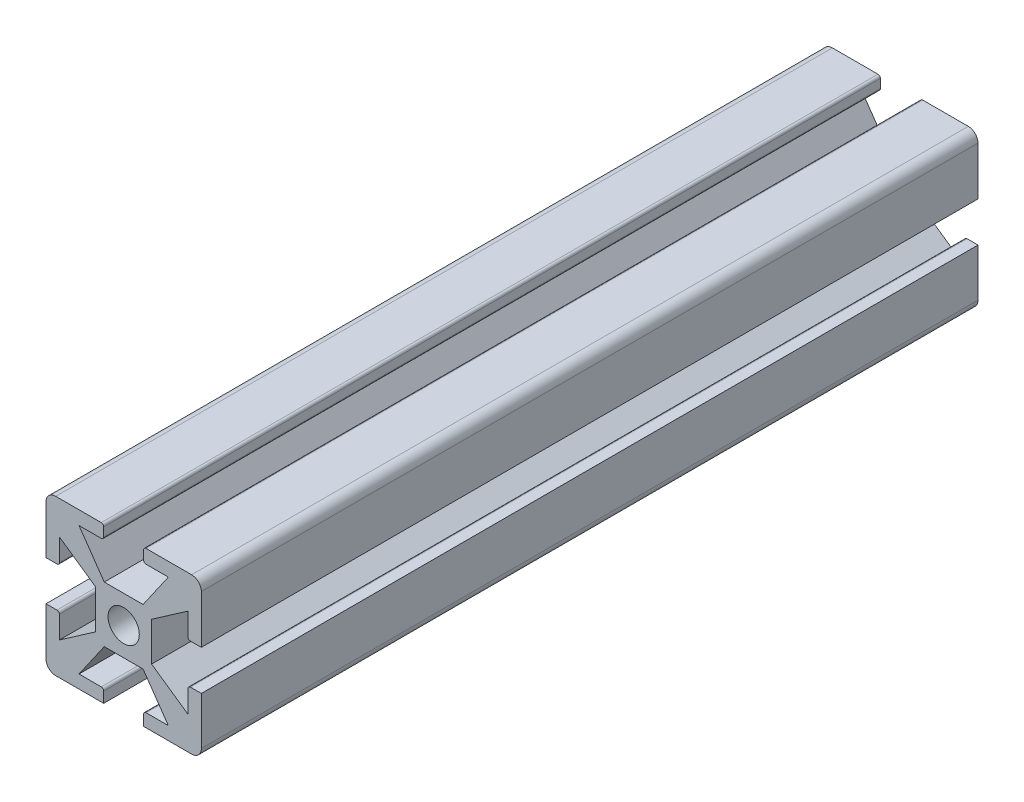
from build123d import *

# Parameters (mm, degrees)
SKETCH1_W           = 25.4
SKETCH1_H           = 25.4
BOSS_EXTRUDE1_DEPTH = 127
FILLET1_R           = 1.5875
HOLE1_OUTLINE_R     = 2.5527
HOLE1_DEPTH         = 127
SKETCH7_W           = 6.5278
SKETCH7_H           = 2.2352
CUT_EXTRUDE2_DEPTH  = 127
FILLET4_R           = 0.396875
CIRPATTERN2_DEPTH   = 127


# Read off the part's stored shape, not the designer's step: Hole1, CirPattern2
with BuildPart() as part:
    # Sketch1 → Boss-Extrude1 (new body)
    with BuildSketch(Plane.XY):
        Rectangle(SKETCH1_W, SKETCH1_H)
    extrude(amount=BOSS_EXTRUDE1_DEPTH)

    # Fillet1
    fillet1_edges = [part.edges().sort_by_distance(p)[0] for p in [
        (12.7, -12.7, 63.5),
        (-12.7, -12.7, 63.5),
        (-12.7, 12.7, 63.5),
        (12.7, 12.7, 63.5),
    ]]
    fillet(fillet1_edges, radius=FILLET1_R)

    # Hole1 outline → Hole1 (cut)
    with BuildSketch(Plane.XY):
        with Locations((0, -0.048792482)):
            Circle(HOLE1_OUTLINE_R)
    extrude(amount=HOLE1_DEPTH, mode=Mode.SUBTRACT)

    # Sketch7 → Cut-Extrude2 (cut)
    with BuildSketch(Plane.XY.offset(127)):
        with Locations((0, 11.5824)):
            Rectangle(SKETCH7_W, SKETCH7_H)
        Polygon((-3.175, 4.5212), (-7.3025, 10.4648), (7.3025, 10.4648), (3.175, 4.5212), align=None)
    extrude(amount=-CUT_EXTRUDE2_DEPTH, mode=Mode.SUBTRACT)

    # Fillet4
    fillet4_edges = [part.edges().sort_by_distance(p)[0] for p in [
        (-3.2639, 10.4648, 63.5),
        (-3.2639, 12.7, 63.5),
        (3.2639, 12.7, 63.5),
        (3.2639, 10.4648, 63.5),
    ]]
    fillet(fillet4_edges, radius=FILLET4_R)

    # CirPattern2 outline → CirPattern2 (cut)
    with BuildSketch(Plane.XY):
        with BuildLine():
            ThreePointArc((-3.660775, -10.562384964), (-3.380141996, -10.67862696), (-3.2639, -10.959259964))
            Line((-3.2639, -10.959259964), (-3.2639, -12.7))
            Line((-3.2639, -12.7), (3.2639, -12.7))
            Line((3.2639, -12.7), (3.2639, -10.959259964))
            ThreePointArc((3.2639, -10.959259964), (3.380141996, -10.67862696), (3.660775, -10.562384964))
            Line((3.660775, -10.562384964), (7.3025, -10.562384964))
            Line((7.3025, -10.562384964), (3.175, -4.618784964))
            Line((3.175, -4.618784964), (-3.175, -4.618784964))
            Line((-3.175, -4.618784964), (-7.3025, -10.562384964))
            Line((-7.3025, -10.562384964), (-3.660775, -10.562384964))
        make_face()
        with BuildLine():
            Line((-12.7, -3.312692482), (-10.910467482, -3.312692482))
            ThreePointArc((-10.910467482, -3.312692482), (-10.629834478, -3.428934478), (-10.513592482, -3.709567482))
            Line((-10.513592482, -3.709567482), (-10.513592482, -7.351292482))
            Line((-10.513592482, -7.351292482), (-4.569992482, -3.223792482))
            Line((-4.569992482, -3.223792482), (-4.569992482, 3.126207518))
            Line((-4.569992482, 3.126207518), (-10.513592482, 7.253707518))
            Line((-10.513592482, 7.253707518), (-10.513592482, 3.611982518))
            ThreePointArc((-10.513592482, 3.611982518), (-10.629834478, 3.331349514), (-10.910467482, 3.215107518))
            Line((-10.910467482, 3.215107518), (-12.7, 3.215107518))
            Line((-12.7, 3.215107518), (-12.7, -3.312692482))
        make_face()
        with BuildLine():
            ThreePointArc((10.513592482, -3.709567482), (10.629834478, -3.428934478), (10.910467482, -3.312692482))
            Line((10.910467482, -3.312692482), (12.7, -3.312692482))
            Line((12.7, -3.312692482), (12.7, 3.215107518))
            Line((12.7, 3.215107518), (10.910467482, 3.215107518))
            ThreePointArc((10.910467482, 3.215107518), (10.629834478, 3.331349514), (10.513592482, 3.611982518))
            Line((10.513592482, 3.611982518), (10.513592482, 7.253707518))
            Line((10.513592482, 7.253707518), (4.569992482, 3.126207518))
            Line((4.569992482, 3.126207518), (4.569992482, -3.223792482))
            Line((4.569992482, -3.223792482), (10.513592482, -7.351292482))
            Line((10.513592482, -7.351292482), (10.513592482, -3.709567482))
        make_face()
    extrude(amount=CIRPATTERN2_DEPTH, mode=Mode.SUBTRACT)


solid = part.part
